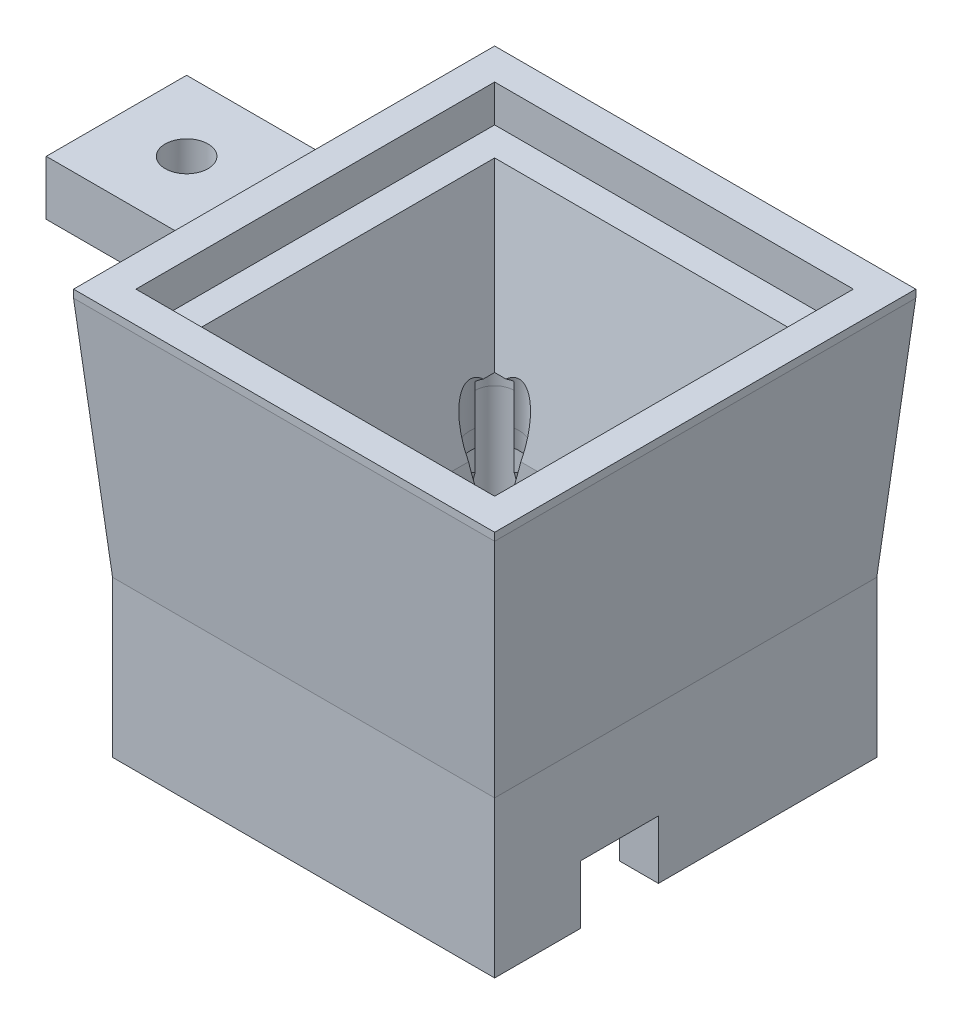
from build123d import *

# Parameters (mm, degrees)
SKETCH1_W           = 39
SKETCH1_H           = 39
SKETCH1_W_2         = 29
SKETCH1_H_2         = 29
BOSS_EXTRUDE1_DEPTH = 3
SKETCH1_3_W         = 49
SKETCH1_3_H         = 49
BOSS_EXTRUDE2_DEPTH = 20
SKETCH3_W           = 40
SKETCH3_H           = 40
BOSS_EXTRUDE4_DEPTH = 1
SKETCH2_W           = 12.666666
SKETCH2_H           = 12.666667
SKETCH2_W_2         = 12.666667
SKETCH2_H_2         = 12.666666
CUT_EXTRUDE1_DEPTH  = 1
SKETCH7_503_W       = 54
SKETCH7_503_H       = 54
SKETCH7_503_W_2     = 40
SKETCH7_503_H_2     = 40
BOSS_EXTRUDE5_DEPTH = 1
CUT_LOFT3_START     = -14.5
CUT_LOFT3_DEPTH     = 29
CUT_LOFT3_START_2   = -20
CUT_LOFT3_2_DEPTH   = 40
CUT_LOFT3_START_3   = -21
CUT_LOFT3_3_DEPTH   = 42
CUT_EXTRUDE3_DEPTH  = 3
CUT_EXTRUDE4_START  = -15
SKETCH17_R          = 3.25
CUT_EXTRUDE4_DEPTH  = 72.001522
CIRPATTERN7_COUNT   = 4
SKETCH18_W          = 5
SKETCH18_H          = 10
CUT_EXTRUDE5_DEPTH  = 7.5
SKETCH19_W          = 46
SKETCH19_H          = 46
CUT_EXTRUDE6_DEPTH  = 4.7625
BOSS_EXTRUDE6_REACH = 88.332
SKETCH20_W          = 18
SKETCH20_H          = 7
SKETCH21_R          = 2.75
CUT_EXTRUDE7_DEPTH  = 7
CUT_EXTRUDE8_DEPTH  = 2.5
CUT_EXTRUDE10_START = -10
CUT_EXTRUDE10_DEPTH = 10


with BuildPart() as part:
    # Sketch1 → Boss-Extrude1 (new body)
    with BuildSketch(Plane(origin=(0, 0, 0), x_dir=(1, 0, 0), z_dir=(0, 1, 0))):
        Rectangle(SKETCH1_W, SKETCH1_H)
        Rectangle(SKETCH1_W_2, SKETCH1_H_2, mode=Mode.SUBTRACT)
    extrude(amount=-BOSS_EXTRUDE1_DEPTH)

    # Sketch1<3> → Boss-Extrude2 (add)
    with BuildSketch(Plane(origin=(0, 0, 0), x_dir=(1, 0, 0), z_dir=(0, 1, 0))):
        Rectangle(SKETCH1_3_W, SKETCH1_3_H)
        with BuildLine():
            ThreePointArc((-19.5, 17), (-21.267767, 21.267767), (-17, 19.5))
            Line((-17, 19.5), (17, 19.5))
            ThreePointArc((17, 19.5), (21.267767, 21.267767), (19.5, 17))
            Line((19.5, 17), (19.5, -17))
            ThreePointArc((19.5, -17), (21.267767, -21.267767), (17, -19.5))
            Line((17, -19.5), (-17, -19.5))
            ThreePointArc((-17, -19.5), (-21.267767, -21.267767), (-19.5, -17))
            Line((-19.5, -17), (-19.5, 17))
        make_face(mode=Mode.SUBTRACT)
    extrude(amount=-BOSS_EXTRUDE2_DEPTH)

    # Sketch14 → Cut-Extrude3 (cut)
    with BuildSketch(Plane.XZ.offset(3)):
        Polygon((14.5, -14.5), (12, -14.5), (17, -19.5), (19.5, -19.5), (19.5, -17), (14.5, -12), align=None)
        Polygon((-19.5, -19.5), (-17, -19.5), (-12, -14.5), (-14.5, -14.5), (-14.5, -12), (-19.5, -17), align=None)
        Polygon((14.5, 14.5), (14.5, 12), (19.5, 17), (19.5, 19.5), (17, 19.5), (12, 14.5), align=None)
        Polygon((-19.5, 17), (-14.5, 12), (-14.5, 14.5), (-12, 14.5), (-17, 19.5), (-19.5, 19.5), align=None)
    extrude(amount=-CUT_EXTRUDE3_DEPTH, mode=Mode.SUBTRACT)


with BuildPart() as body_2:
    # Sketch3 → Boss-Extrude4 (new body)
    with BuildSketch(Plane(origin=(0, 32, 0), x_dir=(1, 0, 0), z_dir=(0, 1, 0))):
        Rectangle(SKETCH3_W, SKETCH3_H)
    extrude(amount=-BOSS_EXTRUDE4_DEPTH)

    # Sketch2 → Cut-Extrude1 (cut)
    with BuildSketch(Plane(origin=(0, 32, 0), x_dir=(1, 0, 0), z_dir=(0, 1, 0))):
        with Locations((0, 13.666666)):
            Rectangle(SKETCH2_W, SKETCH2_H)
        with Locations((13.666666, 13.666666)):
            Rectangle(SKETCH2_W_2, SKETCH2_H)
        with Locations((13.666666, 0)):
            Rectangle(SKETCH2_W_2, SKETCH2_H_2)
        Rectangle(SKETCH2_W, SKETCH2_H_2)
        with Locations((13.666666, -13.666666)):
            Rectangle(SKETCH2_W_2, SKETCH2_H)
        with Locations((0, -13.666666)):
            Rectangle(SKETCH2_W, SKETCH2_H)
        with Locations((-13.666666, -13.666666)):
            Rectangle(SKETCH2_W_2, SKETCH2_H)
        with Locations((-13.666666, 0)):
            Rectangle(SKETCH2_W_2, SKETCH2_H_2)
        with Locations((-13.666666, 13.666666)):
            Rectangle(SKETCH2_W_2, SKETCH2_H)
    extrude(amount=-CUT_EXTRUDE1_DEPTH, mode=Mode.SUBTRACT)

    # Loft4: read off the stored shape, not the designer's step
    # Loft4: loft between two sections, ruled curve by curve
    loft4_from = [
        Edge.make_line((-24.5, 0, -24.5), (-24.5, 0, 24.5)),
        Edge.make_line((24.5, 0, -24.5), (-24.5, 0, -24.5)),
        Edge.make_line((24.5, 0, 24.5), (24.5, 0, -24.5)),
        Edge.make_line((-24.5, 0, 24.5), (24.5, 0, 24.5)),
    ]
    loft4_to = [
        Edge.make_line((-27, 31, -27), (-27, 31, 27)),
        Edge.make_line((27, 31, -27), (-27, 31, -27)),
        Edge.make_line((27, 31, 27), (27, 31, -27)),
        Edge.make_line((-27, 31, 27), (27, 31, 27)),
    ]
    loft4 = Solid(Shell([*[Face.make_surface_from_curves(loft4_from[k], loft4_to[k]) for k in range(4)], Face(Wire(loft4_from)), Face(Wire(loft4_to))]))
    add(loft4)

    # Loft4 2: loft between two sections, ruled curve by curve
    loft4_2_from = [
        Edge.make_line((6.333333, 31, 6.333333), (6.333333, 31, -6.333333)),
        Edge.make_line((6.333333, 31, -6.333333), (6.333333, 31, 6.333333)),
    ]
    loft4_2_to = [
        Edge.make_line((-6.333333, 31, 6.333333), (-6.333333, 31, -6.333333)),
        Edge.make_line((-6.333333, 31, -6.333333), (-6.333333, 31, 6.333333)),
    ]
    loft4_2 = Solid(Shell([*[Face.make_surface_from_curves(loft4_2_from[k], loft4_2_to[k]) for k in range(2)], Face(Wire(loft4_2_from)), Face(Wire(loft4_2_to))]))
    add(loft4_2)

    # Sketch7<503> → Boss-Extrude5 (add)
    with BuildSketch(Plane.XZ.offset(-31)):
        Rectangle(SKETCH7_503_W, SKETCH7_503_H)
        Rectangle(SKETCH7_503_W_2, SKETCH7_503_H_2, mode=Mode.SUBTRACT)
    extrude(amount=-BOSS_EXTRUDE5_DEPTH)

    # Cut-Loft3: read off the stored shape, not the designer's step
    # Cut-Loft3 outline → Cut-Loft3 (cut)
    with BuildSketch(Plane.XY.offset(CUT_LOFT3_START)):
        Polygon((20, 31), (-20, 31), (-14.5, 0), (14.5, 0), align=None)
    extrude(amount=CUT_LOFT3_DEPTH, mode=Mode.SUBTRACT)

    # Cut-Loft3 2 outline → Cut-Loft3 2 (cut)
    with BuildSketch(Plane.YZ.offset(CUT_LOFT3_START_2)):
        Polygon((31, -20), (31, -14.5), (0, -14.5), align=None)
        Polygon((31, 14.5), (31, 20), (0, 14.5), align=None)
    extrude(amount=CUT_LOFT3_2_DEPTH, mode=Mode.SUBTRACT)

    # Cut-Loft3 3 outline → Cut-Loft3 3 (add)
    with BuildSketch(Plane.XY.offset(CUT_LOFT3_START_3)):
        Polygon((20, 31), (14.5, 0), (20, 0), align=None)
        Polygon((-14.5, 0), (-20, 31), (-20, 0), align=None)
    extrude(amount=CUT_LOFT3_3_DEPTH)


with BuildPart() as cut_extrude4_tool:
    # Sketch17 → Cut-Extrude4 (new body)
    with BuildSketch(Plane(origin=(1.696178, -6.590532, 1.696178), x_dir=(0.7071067811865467, 0, -0.7071067811865486), z_dir=(0.24184476264797614, -0.9396926207859081, 0.2418447626479755)).offset(CUT_EXTRUDE4_START)):
        with Locations((0, 19.269428)):
            Circle(SKETCH17_R)
    cut_extrude4 = extrude(amount=CUT_EXTRUDE4_DEPTH)


with BuildPart() as part_1:
    add(part.part)

    # Cut-Extrude4: cut by cut_extrude4_tool
    add(cut_extrude4_tool.part, mode=Mode.SUBTRACT)


with BuildPart() as body_2_1:
    add(body_2.part)

    # Cut-Extrude4: cut by cut_extrude4_tool
    add(cut_extrude4_tool.part, mode=Mode.SUBTRACT)


with BuildPart() as cirpattern7_tool:
    # CirPattern7: Cut-Extrude4 ×4 about axis
    cirpattern7_axis = Axis((0, 32, 0), (0, -1, 0))
    for i in range(1, CIRPATTERN7_COUNT):
        add(cut_extrude4.rotate(cirpattern7_axis, i * 360 / CIRPATTERN7_COUNT))


with BuildPart() as part_2:
    add(part_1.part)

    # CirPattern7: cut by cirpattern7_tool
    add(cirpattern7_tool.part, mode=Mode.SUBTRACT)

    # Sketch18 → Cut-Extrude5 (cut)
    with BuildSketch(Plane.XZ.offset(20)):
        with Locations((22, 8.5)):
            Rectangle(SKETCH18_W, SKETCH18_H)
    extrude(amount=-CUT_EXTRUDE5_DEPTH, mode=Mode.SUBTRACT)


with BuildPart() as body_2_2:
    add(body_2_1.part)

    # CirPattern7: cut by cirpattern7_tool
    add(cirpattern7_tool.part, mode=Mode.SUBTRACT)

    # Sketch19 → Cut-Extrude6 (cut)
    with BuildSketch(Plane(origin=(0, 32, 0), x_dir=(1, 0, 0), z_dir=(0, 1, 0))):
        Rectangle(SKETCH19_W, SKETCH19_H)
    extrude(amount=-CUT_EXTRUDE6_DEPTH, mode=Mode.SUBTRACT)

    # Boss-Extrude6: up to this plane
    boss_extrude6_end = Plane(origin=(-24.5, 0, -24.5), z_dir=(-0.996763955011845, -0.08038418992031061, 0))
    # Sketch20 → Boss-Extrude6 (add, up to the surface)
    with BuildSketch(Plane(origin=(-48.5, 0, 0), x_dir=(0, 0, -1), z_dir=(1, 0, 0)), mode=Mode.PRIVATE) as boss_extrude6_sk1:
        with Locations((0, 23.5)):
            Rectangle(SKETCH20_W, SKETCH20_H)
    boss_extrude6_tool1 = split(extrude(boss_extrude6_sk1.sketch, amount=BOSS_EXTRUDE6_REACH, mode=Mode.PRIVATE), bisect_by=boss_extrude6_end, keep=Keep.BOTH, mode=Mode.PRIVATE)
    add(boss_extrude6_tool1.solids().sort_by_distance((-48.5, 23.5, 0))[0])

    # Sketch21 → Cut-Extrude7 (cut)
    with BuildSketch(Plane(origin=(0, 27, 0), x_dir=(1, 0, 0), z_dir=(0, 1, 0))):
        with Locations(Location((-39.5, 0, 0), (0, 0, 270))):
            Circle(SKETCH21_R)
    extrude(amount=-CUT_EXTRUDE7_DEPTH, mode=Mode.SUBTRACT)

    # Sketch22 → Cut-Extrude8 (cut)
    with BuildSketch(Plane.XZ.offset(-20)):
        Polygon((-44.234272, 0), (-41.867136, -4.1), (-37.132864, -4.1), (-34.765728, 0), (-37.132864, 4.1), (-41.867136, 4.1), align=None)
    extrude(amount=-CUT_EXTRUDE8_DEPTH, mode=Mode.SUBTRACT)

    # Sketch14<4> → Cut-Extrude10 (cut)
    with BuildSketch(Plane.XZ.offset(3).offset(CUT_EXTRUDE10_START)):
        with BuildLine():
            ThreePointArc((19.5, 17), (21.267767, 21.267767), (17, 19.5))
            Line((17, 19.5), (19.5, 19.5))
            Line((19.5, 19.5), (19.5, 17))
        make_face()
        Polygon((14.5, 14.5), (14.5, 12), (19.5, 17), (19.5, 19.5), (17, 19.5), (12, 14.5), align=None)
        with BuildLine():
            ThreePointArc((17, -19.5), (21.267767, -21.267767), (19.5, -17))
            Line((19.5, -17), (19.5, -19.5))
            Line((19.5, -19.5), (17, -19.5))
        make_face()
        Polygon((14.5, -14.5), (12, -14.5), (17, -19.5), (19.5, -19.5), (19.5, -17), (14.5, -12), align=None)
        Polygon((-19.5, -19.5), (-17, -19.5), (-12, -14.5), (-14.5, -14.5), (-14.5, -12), (-19.5, -17), align=None)
        with BuildLine():
            ThreePointArc((-19.5, -17), (-21.267767, -21.267767), (-17, -19.5))
            Line((-17, -19.5), (-19.5, -19.5))
            Line((-19.5, -19.5), (-19.5, -17))
        make_face()
        with BuildLine():
            ThreePointArc((-17, 19.5), (-21.267767, 21.267767), (-19.5, 17))
            Line((-19.5, 17), (-19.5, 19.5))
            Line((-19.5, 19.5), (-17, 19.5))
        make_face()
        Polygon((-19.5, 17), (-14.5, 12), (-14.5, 14.5), (-12, 14.5), (-17, 19.5), (-19.5, 19.5), align=None)
    extrude(amount=CUT_EXTRUDE10_DEPTH, mode=Mode.SUBTRACT)


solid = Compound([part_2.part, body_2_2.part])
